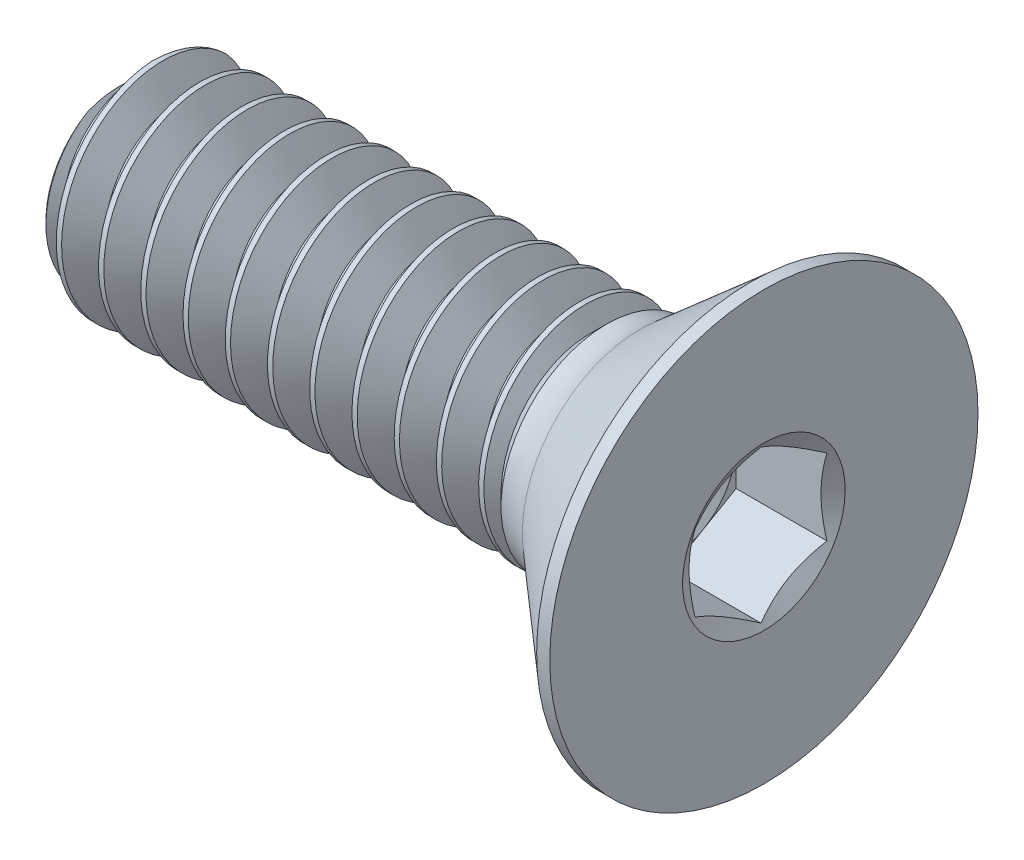
from build123d import *

# Parameters (mm, degrees)
CUT_EXTRUDE1_DEPTH = 2.8194
DELETEFACE1_START  = 5
DELETEFACE1_DEPTH  = 1.7056
CUT_SWEEP1_PITCH   = 1.27
CUT_SWEEP1_TO      = 15.339142


with BuildPart() as part:
    # Sketch3 → Revolve1 (revolve)
    with BuildSketch(Plane.XY, mode=Mode.PRIVATE) as revolve1_sk:
        with BuildLine():
            Line((-8.89, 3.175), (-9.525, 2.54))
            Line((-9.525, 2.54), (-9.525, 0))
            Line((-9.525, 0), (9.525, 0))
            Line((9.525, 0), (9.525, 6.4389))
            Line((9.525, 6.4389), (9.130538673, 6.4389))
            Line((9.130538673, 6.4389), (5.814141592, 3.556))
            ThreePointArc((5.814141592, 3.556), (5.339074209, 3.273364608), (4.795110803, 3.175))
            Line((4.795110803, 3.175), (-8.89, 3.175))
        make_face()
    revolve(revolve1_sk.sketch.rotate(Axis((9.525, 0, 0), (-1, 0, 0)), 90), axis=Axis((9.525, 0, 0), (-1, 0, 0)))

    # Sketch4 → Cut-Extrude1 (cut)
    with BuildSketch(Plane(origin=(9.525, 0, 0), x_dir=(0, 0, -1), z_dir=(1, 0, 0))):
        Polygon((0, 2.291358881), (-1.984375, 1.14567944), (-1.984375, -1.14567944), (0, -2.291358881), (1.984375, -1.14567944), (1.984375, 1.14567944), align=None)
    extrude(amount=-CUT_EXTRUDE1_DEPTH, mode=Mode.SUBTRACT)

    # Cut-Extrude2 cone 1 section (through the dimple's axis) → Cut-Extrude2 (revolve, cut)
    with BuildSketch(Plane(origin=(9.525, 0, 0), x_dir=(0, 0, -1), z_dir=(0, 1, 0))):
        Polygon((0, 0), (2.444850821, 0), (0, 1.41153528), align=None)
    revolve(axis=Axis((9.525, 0, 0), (-1, 0, 0)), mode=Mode.SUBTRACT)

    # Cut-Extrude3 cone 1 section (through the dimple's axis) → Cut-Extrude3 (revolve, cut)
    with BuildSketch(Plane(origin=(6.7056, 0, 0), x_dir=(0, 0, -1), z_dir=(0, 1, 0))):
        Polygon((0, 0), (1.984375, 0), (0, 1.14567944), align=None)
    revolve(axis=Axis((6.7056, 0, 0), (-1, 0, 0)), mode=Mode.SUBTRACT)

    # DeleteFace1: read off the stored shape, not the designer's step
    # DeleteFace1 outline → DeleteFace1 (add)
    with BuildSketch(Plane.YZ.offset(DELETEFACE1_START)):
        Polygon((-1.14567944, -1.984375), (1.14567944, -1.984375), (2.291358881, 0), (1.14567944, 1.984375), (-1.14567944, 1.984375), (-2.291358881, 0), align=None)
    extrude(amount=DELETEFACE1_DEPTH)


with BuildPart() as body_2:
    # Split1: the piece on the far side of the plane
    add(part.part)
    split(bisect_by=Plane(origin=(5.814141592, 0, 0), x_dir=(0, 0, 1), z_dir=(1, 0, 0)), keep=Keep.BOTTOM)

    # Cut-Sweep1: arcs per turn and ends read off the stored shape
    # Cut-Sweep1: the profile of Sketch7 screwed along a right-hand helix through 15 turns, 8 arcs to a turn; built about Z, then put on its axis
    cut_sweep1_z = Axis((0, 0, 0), (0, 0, 1))
    cut_sweep1_corners = [(2.350110803, 0, -0.635), (3.243740766, 0, -1.1509375), (3.243740766, 0, 0.0396875), (2.350110803, 0, -0.47625)]
    with BuildLine(mode=Mode.PRIVATE) as cut_sweep1_profile:
        Line(cut_sweep1_corners[0], cut_sweep1_corners[1])
        Line(cut_sweep1_corners[1], cut_sweep1_corners[2])
        Line(cut_sweep1_corners[2], cut_sweep1_corners[3])
        Line(cut_sweep1_corners[3], cut_sweep1_corners[0])
    cut_sweep1_cap = Face(cut_sweep1_profile.wire())
    cut_sweep1_turn_angles = [0, 22.5, 45, 67.5, 90, 112.5, 135, 157.5, 180, 202.5, 225, 247.5, 270, 292.5, 315, 337.5, 360]
    cut_sweep1_turn_weights = [1, 0.9238795325112867, 1, 0.9238795325112867, 1, 0.9238795325112867, 1, 0.9238795325112867, 1, 0.9238795325112867, 1, 0.9238795325112867, 1, 0.9238795325112867, 1, 0.9238795325112867, 1]
    cut_sweep1_turn_rails = [Edge.make_bspline([Vector(p[0], p[1], 0).rotate(cut_sweep1_z, cut_sweep1_turn_angles[k]) / cut_sweep1_turn_weights[k] + Vector(0, 0, p[2] + CUT_SWEEP1_PITCH * cut_sweep1_turn_angles[k] / 360) for k in range(17)], [0, 0, 0, 1, 1, 2, 2, 3, 3, 4, 4, 5, 5, 6, 6, 7, 7, 8, 8, 8], 2, cut_sweep1_turn_weights) for p in cut_sweep1_corners]
    cut_sweep1_turn_sides = [Face.make_surface_from_curves(cut_sweep1_turn_rails[p[0]], cut_sweep1_turn_rails[p[1]]) for p in [(0, 1), (1, 2), (2, 3), (3, 0)]]
    cut_sweep1 = Plane(origin=(-9.525, 0, 0), x_dir=(0, -1, 0), z_dir=(1, 0, 0)) * split(Solid(Shell([*[p.moved(Location((0, 0, CUT_SWEEP1_PITCH * i))) for i in range(15) for p in cut_sweep1_turn_sides], cut_sweep1_cap, cut_sweep1_cap.rotate(cut_sweep1_z, 5400).moved(Location((0, 0, CUT_SWEEP1_PITCH * 5400 / 360)))])), bisect_by=Plane.XY.offset(CUT_SWEEP1_TO), keep=Keep.BOTTOM, mode=Mode.PRIVATE)
    add(cut_sweep1, mode=Mode.SUBTRACT)


with BuildPart() as part_1:
    add(part.part)

    # Split1
    split(bisect_by=Plane(origin=(5.814141592, 0, 0), x_dir=(0, 0, 1), z_dir=(1, 0, 0)), keep=Keep.TOP)

    add(body_2.part)  # Revolve2 merges body 2
    # Sketch9 → Revolve2 (revolve)
    with BuildSketch(Plane.XY, mode=Mode.PRIVATE) as revolve2_sk:
        with BuildLine():
            Line((4.795110803, 3.175), (4.795110803, 0))
            Line((4.795110803, 0), (5.814141592, 0))
            Line((5.814141592, 0), (5.814141592, 3.556))
            ThreePointArc((5.814141592, 3.556), (5.339074209, 3.273364608), (4.795110803, 3.175))
        make_face()
    revolve(revolve2_sk.sketch.rotate(Axis((4.795110803, 0, 0), (1, 0, 0)), 270), axis=Axis((4.795110803, 0, 0), (1, 0, 0)))

    # Cut-Extrude4 cone 1 section (through the dimple's axis) → Cut-Extrude4 (revolve, cut)
    with BuildSketch(Plane(origin=(6.7056, 0, 0), x_dir=(0, 0, -1), z_dir=(0, 1, 0))):
        Polygon((0, 0), (1.984375, 0), (0, 1.14567944), align=None)
    revolve(axis=Axis((6.7056, 0, 0), (-1, 0, 0)), mode=Mode.SUBTRACT)

    # Boss-Extrude1: read off the stored shape, not the designer's step
    # Boss-Extrude1 outline → Boss-Extrude1 (revolve)
    with BuildSketch(Plane.YX):
        Polygon((2.350104501, 4.795110803), (2.350104501, 3.970215304), (3.175, 4.795110803), align=None)
    revolve(axis=Axis((0, 0, 0), (1, 0, 0)))


solid = part_1.part
